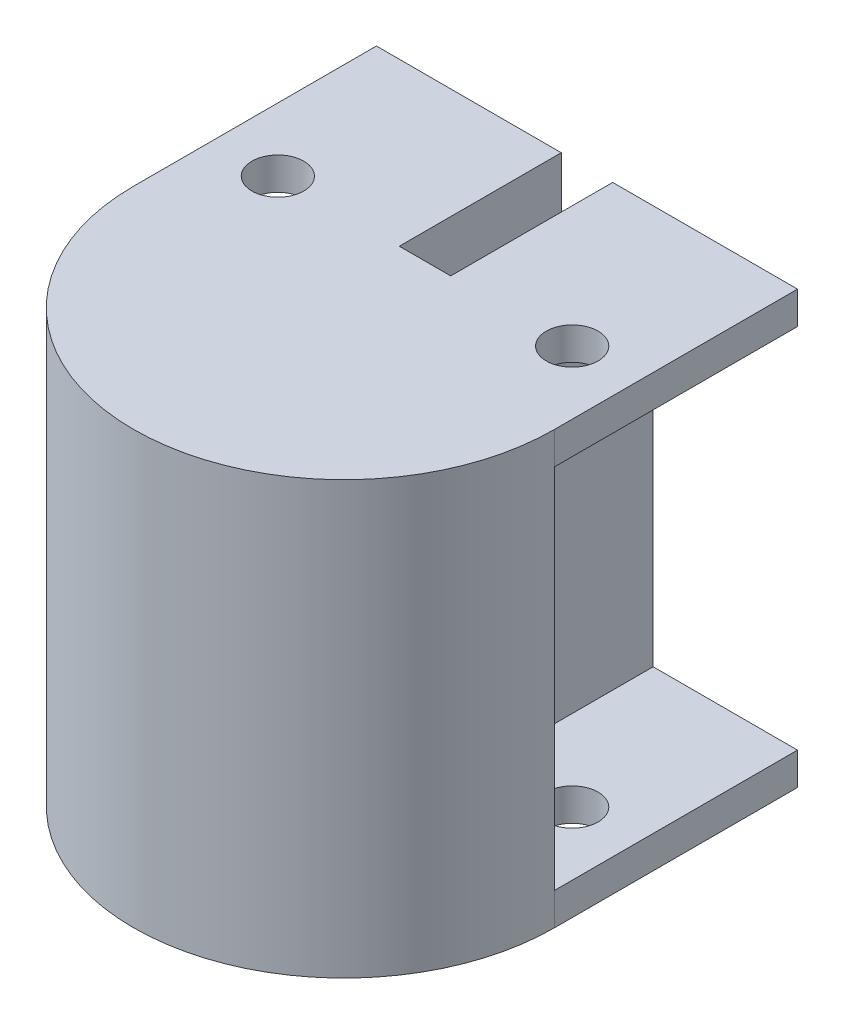
from build123d import *

# Parameters (mm, degrees)
SKETCH1_R           = 1.6
BOSS_EXTRUDE1_DEPTH = 2
BOSS_EXTRUDE3_START = 11.325
BOSS_EXTRUDE3_DEPTH = 11.325


with BuildPart() as part:
    # Sketch1 → Boss-Extrude1 (new body)
    with BuildSketch(Plane(origin=(0, 0, 0), x_dir=(1, 0, 0), z_dir=(0, 1, 0))):
        with BuildLine():
            Line((-1.5875, 0), (1.5875, 0))
            Line((1.5875, 0), (1.5875, 10))
            Line((1.5875, 10), (13, 10))
            Line((13, 10), (13, -5))
            ThreePointArc((13, -5), (0, -18), (-13, -5))
            Line((-13, -5), (-13, 10))
            Line((-13, 10), (-1.5875, 10))
            Line((-1.5875, 10), (-1.5875, 0))
        make_face()
        with Locations((9.0875, 0)):
            Circle(SKETCH1_R, mode=Mode.SUBTRACT)
        with Locations((-9.0875, 0)):
            Circle(SKETCH1_R, mode=Mode.SUBTRACT)
    boss_extrude1 = extrude(amount=BOSS_EXTRUDE1_DEPTH)

    # Sketch3 → Boss-Extrude3 (add)
    with BuildSketch(Plane.XZ.offset(BOSS_EXTRUDE3_START)):
        with BuildLine():
            Line((4.0875, -10), (1.5875, -10))
            Line((1.5875, -10), (1.5875, 0))
            Line((1.5875, 0), (-1.5875, 0))
            Line((-1.5875, 0), (-1.5875, -10))
            Line((-1.5875, -10), (-4.0875, -10))
            Line((-4.0875, -10), (-4.0875, 5))
            Line((-4.0875, 5), (-13, 5))
            ThreePointArc((-13, 5), (0, 18), (13, 5))
            Line((13, 5), (4.0875, 5))
            Line((4.0875, 5), (4.0875, -10))
        make_face()
    boss_extrude3 = extrude(amount=-BOSS_EXTRUDE3_DEPTH)

    # Mirror11: Boss-Extrude3 across plane
    add(boss_extrude3.mirror(Plane(origin=(0, -11.325, 0), x_dir=(0, 0, 1), z_dir=(0, -1, 0))))

    # Mirror12: Boss-Extrude1 across plane
    add(boss_extrude1.mirror(Plane(origin=(0, -11.325, 0), x_dir=(0, 0, 1), z_dir=(0, -1, 0))))


solid = part.part
